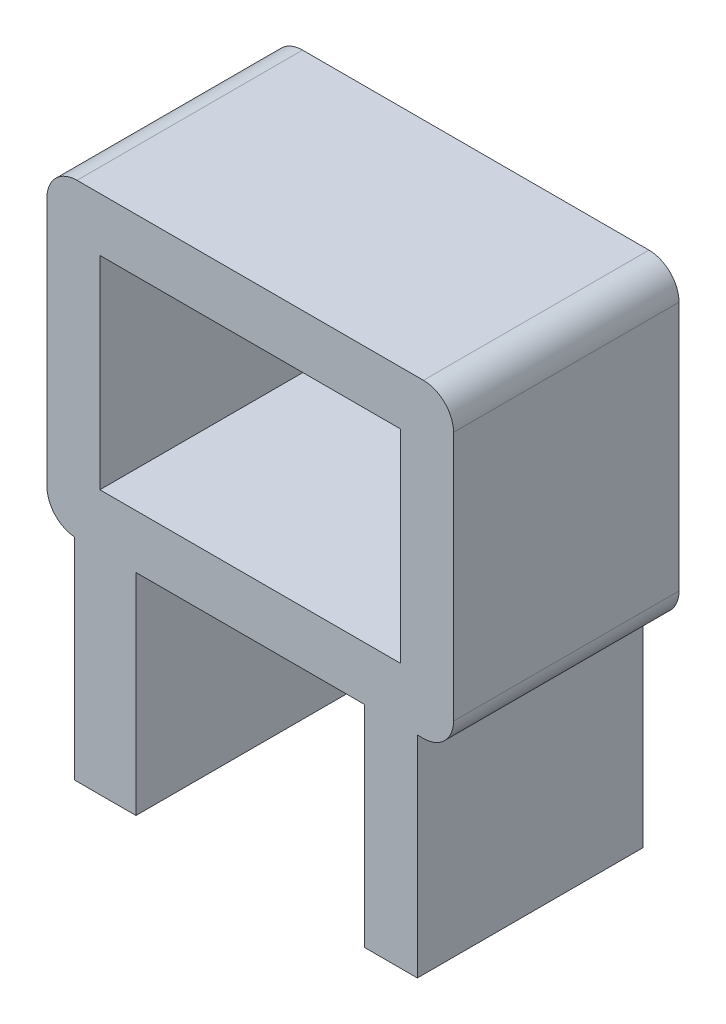
from build123d import *

# Parameters (mm, degrees)
SKETCH1_W           = 20
SKETCH1_H           = 13.5
BOSS_EXTRUDE1_DEPTH = 15
FILLET1_R           = 2


with BuildPart() as part:
    # Sketch1 → Boss-Extrude1 (new body)
    with BuildSketch(Plane.XY):
        Polygon((-25.825109991, 19.935146109), (1.215675598, 19.935146109), (1.215675598, -0.694178906), (-1.188139158, -0.694178906), (-1.188139158, -14.694178906), (-1.542833918, -14.694178906), (-4.704717196, -14.694178906), (-4.704717196, -0.694178906), (-19.904717196, -0.694178906), (-19.904717196, -14.694178906), (-24.006835368, -14.694178906), (-24.006835368, -0.694178906), (-25.825109991, -0.694178906), align=None)
        with Locations((-12.304717196, 9.620483601)):
            Rectangle(SKETCH1_W, SKETCH1_H, mode=Mode.SUBTRACT)
    extrude(amount=BOSS_EXTRUDE1_DEPTH)

    # Fillet1
    # the kernel refuses this fillet: 2 mm, written as the material it takes off along each edge
    with BuildSketch(Plane(origin=(-25.825109991, -0.694178906, -4.979317152), x_dir=(1, 0, 0), z_dir=(0, 0, 1))) as fillet1_piece_1:
        with BuildLine():
            CenterArc((2, 1.991726861), FILLET1_R, 180, 84.786761144)
            Line((0, 1.991726861), (-0.04, 1.991726861))
            Line((-0.04, 1.991726861), (-0.04, 0))
            Line((-0.04, 0), (0, -0.04))
            ThreePointArc((0, -0.04), (0.909137312, -0.04), (1.814640116, -0.039834537))
            Line((1.814640116, -0.039834537), (1.818274623, 0))
        make_face()
    extrude(amount=24.958634303, mode=Mode.SUBTRACT)
    with BuildSketch(Plane(origin=(-25.825109991, 19.935146109, -5), x_dir=(1, 0, 0), z_dir=(0, 0, 1)), Plane(origin=(1.215675598, -0.694178906, -5), x_dir=(-1, 0, 0), z_dir=(0, 0, 1))) as fillet1_piece_2:
        with BuildLine():
            CenterArc((FILLET1_R, -FILLET1_R), FILLET1_R, 90, 90)
            Line((0, -FILLET1_R), (-FILLET1_R * 0.02, -FILLET1_R))
            Line((-FILLET1_R * 0.02, -FILLET1_R), (-FILLET1_R * 0.02, FILLET1_R * 0.02))
            Line((-FILLET1_R * 0.02, FILLET1_R * 0.02), (FILLET1_R, FILLET1_R * 0.02))
            Line((FILLET1_R, FILLET1_R * 0.02), (FILLET1_R, 0))
        make_face()
    extrude(amount=25, mode=Mode.SUBTRACT)
    with BuildSketch(Plane(origin=(1.215675598, 19.935146109, -5), x_dir=(-1, 0, 0), z_dir=(0, 0, 1))) as fillet1_piece_3:
        with BuildLine():
            CenterArc((FILLET1_R, FILLET1_R), FILLET1_R, 180, 90)
            Line((0, FILLET1_R), (-FILLET1_R * 0.02, FILLET1_R))
            Line((-FILLET1_R * 0.02, FILLET1_R), (-FILLET1_R * 0.02, -FILLET1_R * 0.02))
            Line((-FILLET1_R * 0.02, -FILLET1_R * 0.02), (FILLET1_R, -FILLET1_R * 0.02))
            Line((FILLET1_R, -FILLET1_R * 0.02), (FILLET1_R, 0))
        make_face()
    extrude(amount=25, mode=Mode.SUBTRACT)


solid = part.part
